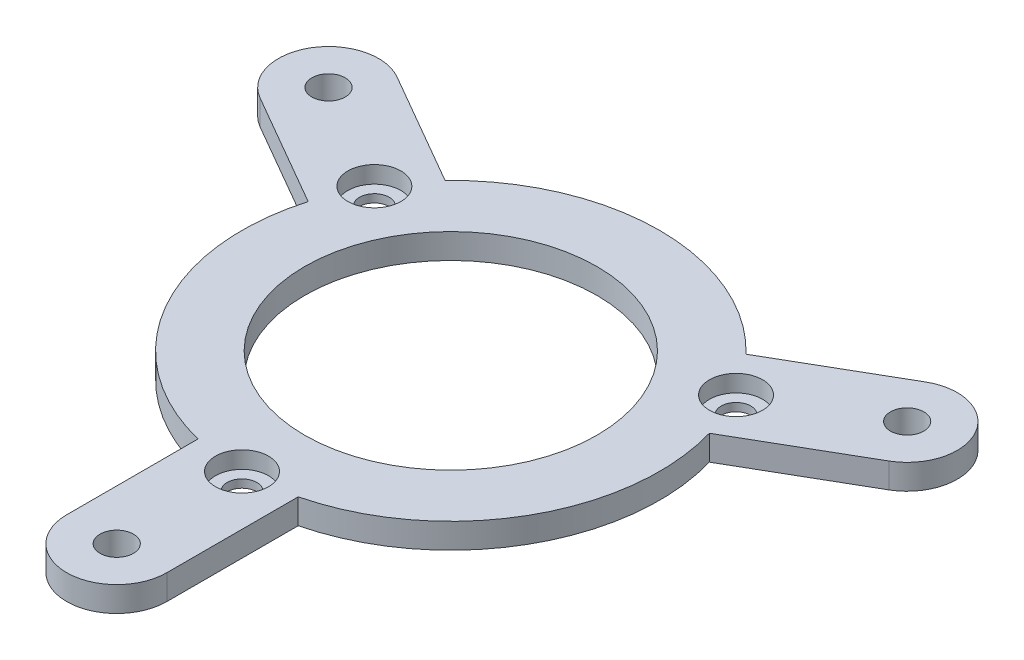
from build123d import *

# Parameters (mm, degrees)
SKETCH1_R                                      = 8.75
SKETCH1_R_2                                    = 1
BOSS_EXTRUDE1_DEPTH                            = 1.5
CBORE_FOR_0_SOCKET_HEAD_CAP_SCREW1_D           = 1.778
CBORE_FOR_0_SOCKET_HEAD_CAP_SCREW1_CBORE_D     = 3.175
CBORE_FOR_0_SOCKET_HEAD_CAP_SCREW1_CBORE_DEPTH = 1.016


with BuildPart() as part:
    # Sketch1 → Boss-Extrude1 (new body)
    with BuildSketch(Plane(origin=(0, 0, 0), x_dir=(1, 0, 0), z_dir=(0, 1, 0))):
        with BuildLine():
            Line((12.008924778, 3.469254338), (18.820508076, 7.401923789))
            ThreePointArc((18.820508076, 7.401923789), (19.918584287, 11.5), (15.820508076, 12.598076211))
            Line((15.820508076, 12.598076211), (9.008924778, 8.665406761))
            ThreePointArc((9.008924778, 8.665406761), (0, 12.5), (-9.008924778, 8.665406761))
            Line((-9.008924778, 8.665406761), (-15.820508076, 12.598076211))
            ThreePointArc((-15.820508076, 12.598076211), (-19.918584287, 11.5), (-18.820508076, 7.401923789))
            Line((-18.820508076, 7.401923789), (-12.008924778, 3.469254338))
            ThreePointArc((-12.008924778, 3.469254338), (-10.825317547, -6.25), (-3, -12.1346611))
            Line((-3, -12.1346611), (-3, -20))
            ThreePointArc((-3, -20), (0, -23), (3, -20))
            Line((3, -20), (3, -12.1346611))
            ThreePointArc((3, -12.1346611), (10.825317547, -6.25), (12.008924778, 3.469254338))
        make_face()
        Circle(SKETCH1_R, mode=Mode.SUBTRACT)
        with Locations((17.320508076, 10)):
            Circle(SKETCH1_R_2, mode=Mode.SUBTRACT)
        with Locations((0, -20)):
            Circle(SKETCH1_R_2, mode=Mode.SUBTRACT)
        with Locations((-17.320508076, 10)):
            Circle(SKETCH1_R_2, mode=Mode.SUBTRACT)
    extrude(amount=BOSS_EXTRUDE1_DEPTH)

    # CBORE for #0 Socket Head Cap Screw1 (through all)
    with Locations(Plane(origin=(0, 1.5, 0), x_dir=(1, 0, 0), z_dir=(0, 1, 0))):
        with Locations((-10.825317547, 6.25), (10.825317547, 6.25), (0, -12.5)):
            CounterBoreHole(CBORE_FOR_0_SOCKET_HEAD_CAP_SCREW1_D / 2, CBORE_FOR_0_SOCKET_HEAD_CAP_SCREW1_CBORE_D / 2, CBORE_FOR_0_SOCKET_HEAD_CAP_SCREW1_CBORE_DEPTH)


solid = part.part
